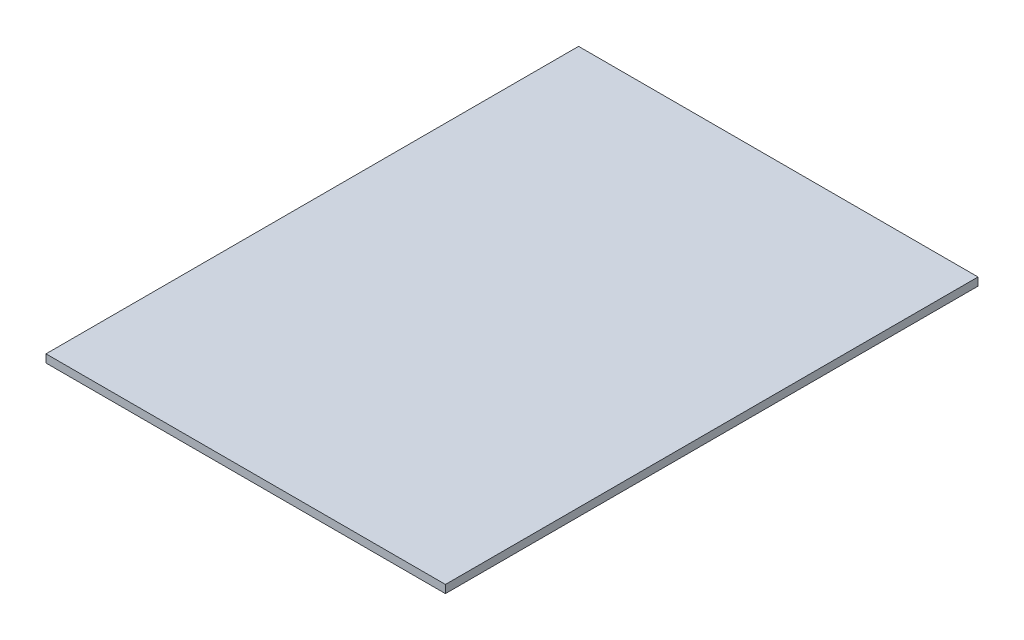
from build123d import *

# Parameters (mm, degrees)
SKETCH1_W           = 150
SKETCH1_H           = 200
BOSS_EXTRUDE1_DEPTH = 3


with BuildPart() as part:
    # Sketch1 → Boss-Extrude1 (new body)
    with BuildSketch(Plane(origin=(0, 0, 0), x_dir=(1, 0, 0), z_dir=(0, 1, 0))):
        Rectangle(SKETCH1_W, SKETCH1_H)
    extrude(amount=BOSS_EXTRUDE1_DEPTH)


solid = part.part
